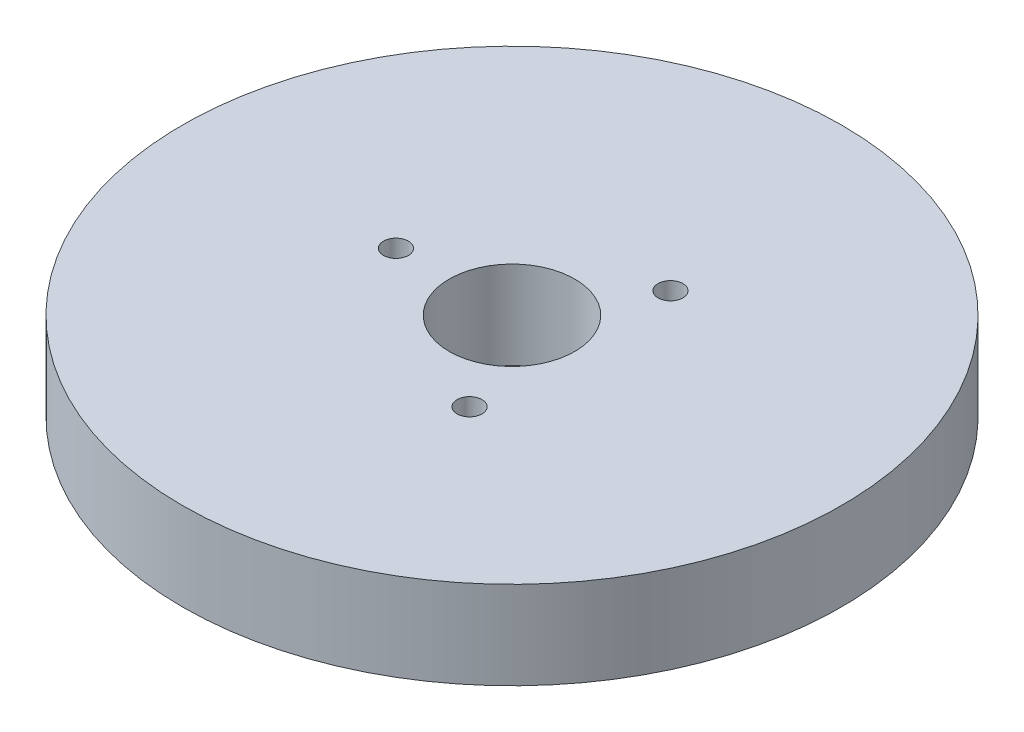
from build123d import *

# Parameters (mm, degrees)
SKETCH1_R           = 52.5
BOSS_EXTRUDE1_DEPTH = 14
SKETCH2_R           = 10
CUT_EXTRUDE1_DEPTH  = 76.554616007
SKETCH3_R           = 1.982113702
CUT_EXTRUDE2_DEPTH  = 13.569693352
CIRPATTERN1_COUNT   = 3


with BuildPart() as part:
    # Sketch1 → Boss-Extrude1 (new body)
    with BuildSketch(Plane(origin=(0, 0, 0), x_dir=(1, 0, 0), z_dir=(0, 1, 0))):
        Circle(SKETCH1_R)
    extrude(amount=BOSS_EXTRUDE1_DEPTH)

    # Sketch2 → Cut-Extrude1 (cut, through all)
    with BuildSketch(Plane(origin=(0, 0, 0), x_dir=(1, 0, 0), z_dir=(0, 1, 0))):
        Circle(SKETCH2_R)
    extrude(amount=CUT_EXTRUDE1_DEPTH, mode=Mode.SUBTRACT)

    # Sketch3 → Cut-Extrude2 (cut)
    with BuildSketch(Plane(origin=(0, 14, 0), x_dir=(1, 0, 0), z_dir=(0, 1, 0))):
        with Locations((-18.483081106, 0)):
            Circle(SKETCH3_R)
    cut_extrude2 = extrude(amount=-CUT_EXTRUDE2_DEPTH, mode=Mode.SUBTRACT)

    # CirPattern1: Cut-Extrude2 ×3 about axis
    cirpattern1_axis = Axis((0, 0, 0), (0, 1, 0))
    for i in range(1, CIRPATTERN1_COUNT):
        add(cut_extrude2.rotate(cirpattern1_axis, i * 360 / CIRPATTERN1_COUNT), mode=Mode.SUBTRACT)


solid = part.part
